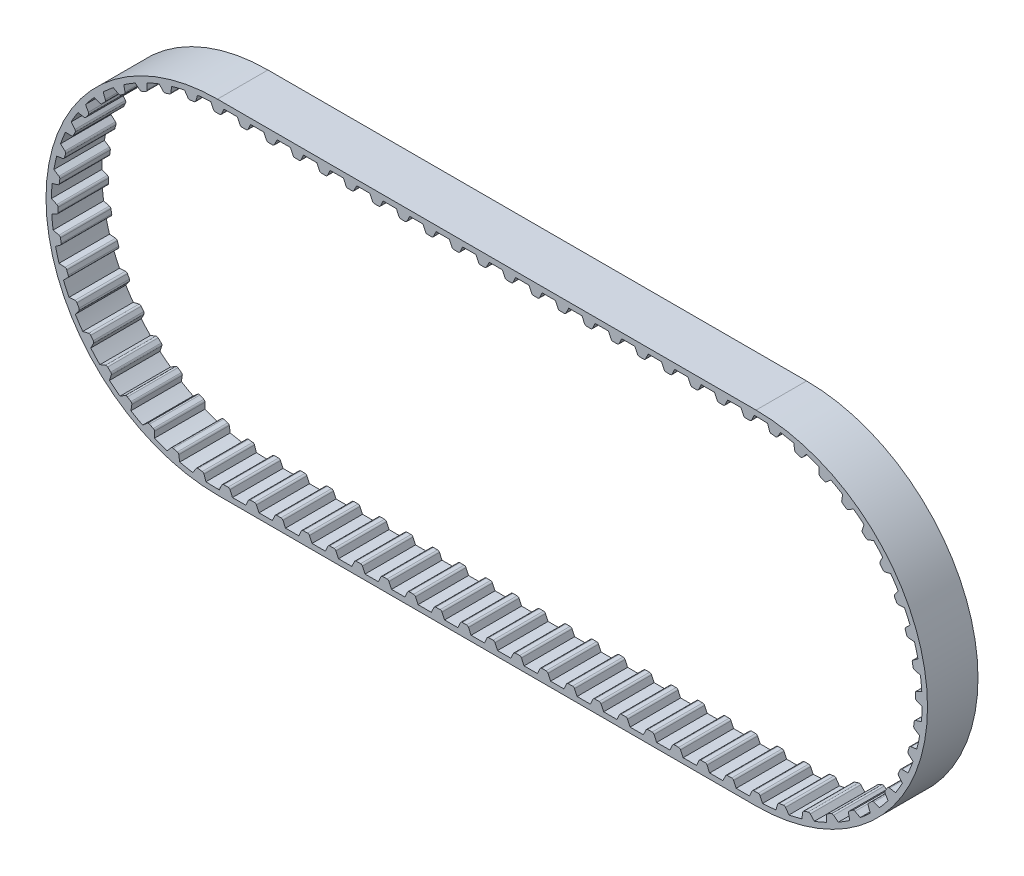
from build123d import *

# Parameters (mm, degrees)
BOSS_EXTRUDE1_DEPTH      = 4.7625
BOSS_EXTRUDE1_DEPTH_BACK = 4.7625
BOSS_EXTRUDE2_DEPTH      = 4.7625
FILLET1_R                = 0.396875
CRVPATTERN1_START        = -4.7625
CRVPATTERN1_DEPTH        = 9.525


# Read off the part's stored shape, not the designer's step: CrvPattern1
with BuildPart() as part:
    # Sketch4 → Boss-Extrude1 (new, two sides: drawn at the far end of the back side and taken through both)
    with BuildSketch(Plane.XY.offset(-BOSS_EXTRUDE1_DEPTH_BACK)):
        with BuildLine():
            Line((-50.8, -32.340284436), (50.8, -32.340284436))
            ThreePointArc((50.8, -32.340284436), (83.140284436, 0), (50.8, 32.340284436))
            Line((50.8, 32.340284436), (-50.8, 32.340284436))
            ThreePointArc((-50.8, 32.340284436), (-83.140284436, 0), (-50.8, -32.340284436))
        make_face()
        with BuildLine():
            Line((-50.8, -31.324284436), (50.8, -31.324284436))
            ThreePointArc((50.8, -31.324284436), (82.124284436, 0), (50.8, 31.324284436))
            Line((50.8, 31.324284436), (-50.8, 31.324284436))
            ThreePointArc((-50.8, 31.324284436), (-82.124284436, 0), (-50.8, -31.324284436))
        make_face(mode=Mode.SUBTRACT)
    extrude(amount=BOSS_EXTRUDE1_DEPTH + BOSS_EXTRUDE1_DEPTH_BACK)

    # Sketch5 → Boss-Extrude2 (add, symmetric)
    with BuildSketch(Plane.XY):
        Polygon((-52.0446, 31.324284436), (-51.452389274, 30.054284436), (-50.147610726, 30.054284436), (-49.5554, 31.324284436), align=None)
    extrude(amount=BOSS_EXTRUDE2_DEPTH, both=True)

    # Fillet1
    fillet1_edges = [part.edges().sort_by_distance(p)[0] for p in [
        (-51.452389274, 30.054284436, 0),
        (-50.147610726, 30.054284436, 0),
    ]]
    fillet(fillet1_edges, radius=FILLET1_R)

    # CrvPattern1 outline → CrvPattern1 (add)
    with BuildSketch(Plane.XY.offset(CRVPATTERN1_START)):
        with BuildLine():
            Line((-45.040553536, 30.283432814), (-44.555196453, 31.324284436))
            Line((-44.555196453, 31.324284436), (-47.044396453, 31.324284436))
            Line((-47.044396453, 31.324284436), (-46.559039371, 30.283432814))
            ThreePointArc((-46.559039371, 30.283432814), (-46.41258925, 30.116438456), (-46.199348468, 30.054284436))
            Line((-46.199348468, 30.054284436), (-45.400244439, 30.054284436))
            ThreePointArc((-45.400244439, 30.054284436), (-45.187003657, 30.116438456), (-45.040553536, 30.283432814))
        make_face()
        with BuildLine():
            Line((-40.040349989, 30.283432814), (-39.554992907, 31.324284436))
            Line((-39.554992907, 31.324284436), (-42.044192907, 31.324284436))
            Line((-42.044192907, 31.324284436), (-41.558835824, 30.283432814))
            ThreePointArc((-41.558835824, 30.283432814), (-41.412385703, 30.116438456), (-41.199144921, 30.054284436))
            Line((-41.199144921, 30.054284436), (-40.400040892, 30.054284436))
            ThreePointArc((-40.400040892, 30.054284436), (-40.18680011, 30.116438456), (-40.040349989, 30.283432814))
        make_face()
        with BuildLine():
            Line((-35.040146443, 30.283432814), (-34.55478936, 31.324284436))
            Line((-34.55478936, 31.324284436), (-37.04398936, 31.324284436))
            Line((-37.04398936, 31.324284436), (-36.558632278, 30.283432814))
            ThreePointArc((-36.558632278, 30.283432814), (-36.412182157, 30.116438456), (-36.198941375, 30.054284436))
            Line((-36.198941375, 30.054284436), (-35.399837346, 30.054284436))
            ThreePointArc((-35.399837346, 30.054284436), (-35.186596564, 30.116438456), (-35.040146443, 30.283432814))
        make_face()
        with BuildLine():
            Line((-30.039942896, 30.283432814), (-29.554585814, 31.324284436))
            Line((-29.554585814, 31.324284436), (-32.043785814, 31.324284436))
            Line((-32.043785814, 31.324284436), (-31.558428731, 30.283432814))
            ThreePointArc((-31.558428731, 30.283432814), (-31.41197861, 30.116438456), (-31.198737828, 30.054284436))
            Line((-31.198737828, 30.054284436), (-30.399633799, 30.054284436))
            ThreePointArc((-30.399633799, 30.054284436), (-30.186393017, 30.116438456), (-30.039942896, 30.283432814))
        make_face()
        with BuildLine():
            Line((-25.03973935, 30.283432814), (-24.554382267, 31.324284436))
            Line((-24.554382267, 31.324284436), (-27.043582267, 31.324284436))
            Line((-27.043582267, 31.324284436), (-26.558225184, 30.283432814))
            ThreePointArc((-26.558225184, 30.283432814), (-26.411775063, 30.116438456), (-26.198534281, 30.054284436))
            Line((-26.198534281, 30.054284436), (-25.399430253, 30.054284436))
            ThreePointArc((-25.399430253, 30.054284436), (-25.186189471, 30.116438456), (-25.03973935, 30.283432814))
        make_face()
        with BuildLine():
            Line((-20.039535803, 30.283432814), (-19.55417872, 31.324284436))
            Line((-19.55417872, 31.324284436), (-22.04337872, 31.324284436))
            Line((-22.04337872, 31.324284436), (-21.558021638, 30.283432814))
            ThreePointArc((-21.558021638, 30.283432814), (-21.411571517, 30.116438456), (-21.198330735, 30.054284436))
            Line((-21.198330735, 30.054284436), (-20.399226706, 30.054284436))
            ThreePointArc((-20.399226706, 30.054284436), (-20.185985924, 30.116438456), (-20.039535803, 30.283432814))
        make_face()
        with BuildLine():
            Line((-15.039332256, 30.283432814), (-14.553975174, 31.324284436))
            Line((-14.553975174, 31.324284436), (-17.043175174, 31.324284436))
            Line((-17.043175174, 31.324284436), (-16.557818091, 30.283432814))
            ThreePointArc((-16.557818091, 30.283432814), (-16.41136797, 30.116438456), (-16.198127188, 30.054284436))
            Line((-16.198127188, 30.054284436), (-15.399023159, 30.054284436))
            ThreePointArc((-15.399023159, 30.054284436), (-15.185782377, 30.116438456), (-15.039332256, 30.283432814))
        make_face()
        with BuildLine():
            Line((-10.03912871, 30.283432814), (-9.553771627, 31.324284436))
            Line((-9.553771627, 31.324284436), (-12.042971627, 31.324284436))
            Line((-12.042971627, 31.324284436), (-11.557614545, 30.283432814))
            ThreePointArc((-11.557614545, 30.283432814), (-11.411164424, 30.116438456), (-11.197923642, 30.054284436))
            Line((-11.197923642, 30.054284436), (-10.398819613, 30.054284436))
            ThreePointArc((-10.398819613, 30.054284436), (-10.185578831, 30.116438456), (-10.03912871, 30.283432814))
        make_face()
        with BuildLine():
            Line((-5.038925163, 30.283432814), (-4.553568081, 31.324284436))
            Line((-4.553568081, 31.324284436), (-7.042768081, 31.324284436))
            Line((-7.042768081, 31.324284436), (-6.557410998, 30.283432814))
            ThreePointArc((-6.557410998, 30.283432814), (-6.410960877, 30.116438456), (-6.197720095, 30.054284436))
            Line((-6.197720095, 30.054284436), (-5.398616066, 30.054284436))
            ThreePointArc((-5.398616066, 30.054284436), (-5.185375284, 30.116438456), (-5.038925163, 30.283432814))
        make_face()
        with BuildLine():
            Line((-0.038721617, 30.283432814), (0.446635466, 31.324284436))
            Line((0.446635466, 31.324284436), (-2.042564534, 31.324284436))
            Line((-2.042564534, 31.324284436), (-1.557207451, 30.283432814))
            ThreePointArc((-1.557207451, 30.283432814), (-1.41075733, 30.116438456), (-1.197516548, 30.054284436))
            Line((-1.197516548, 30.054284436), (-0.39841252, 30.054284436))
            ThreePointArc((-0.39841252, 30.054284436), (-0.185171738, 30.116438456), (-0.038721617, 30.283432814))
        make_face()
        with BuildLine():
            Line((4.96148193, 30.283432814), (5.446839013, 31.324284436))
            Line((5.446839013, 31.324284436), (2.957639013, 31.324284436))
            Line((2.957639013, 31.324284436), (3.442996095, 30.283432814))
            ThreePointArc((3.442996095, 30.283432814), (3.589446216, 30.116438456), (3.802686998, 30.054284436))
            Line((3.802686998, 30.054284436), (4.601791027, 30.054284436))
            ThreePointArc((4.601791027, 30.054284436), (4.815031809, 30.116438456), (4.96148193, 30.283432814))
        make_face()
        with BuildLine():
            Line((9.961685477, 30.283432814), (10.447042559, 31.324284436))
            Line((10.447042559, 31.324284436), (7.957842559, 31.324284436))
            Line((7.957842559, 31.324284436), (8.443199642, 30.283432814))
            ThreePointArc((8.443199642, 30.283432814), (8.589649763, 30.116438456), (8.802890545, 30.054284436))
            Line((8.802890545, 30.054284436), (9.601994574, 30.054284436))
            ThreePointArc((9.601994574, 30.054284436), (9.815235356, 30.116438456), (9.961685477, 30.283432814))
        make_face()
        with BuildLine():
            Line((14.961889023, 30.283432814), (15.447246106, 31.324284436))
            Line((15.447246106, 31.324284436), (12.958046106, 31.324284436))
            Line((12.958046106, 31.324284436), (13.443403188, 30.283432814))
            ThreePointArc((13.443403188, 30.283432814), (13.589853309, 30.116438456), (13.803094091, 30.054284436))
            Line((13.803094091, 30.054284436), (14.60219812, 30.054284436))
            ThreePointArc((14.60219812, 30.054284436), (14.815438902, 30.116438456), (14.961889023, 30.283432814))
        make_face()
        with BuildLine():
            Line((19.96209257, 30.283432814), (20.447449652, 31.324284436))
            Line((20.447449652, 31.324284436), (17.958249652, 31.324284436))
            Line((17.958249652, 31.324284436), (18.443606735, 30.283432814))
            ThreePointArc((18.443606735, 30.283432814), (18.590056856, 30.116438456), (18.803297638, 30.054284436))
            Line((18.803297638, 30.054284436), (19.602401667, 30.054284436))
            ThreePointArc((19.602401667, 30.054284436), (19.815642449, 30.116438456), (19.96209257, 30.283432814))
        make_face()
        with BuildLine():
            Line((24.962296116, 30.283432814), (25.447653199, 31.324284436))
            Line((25.447653199, 31.324284436), (22.958453199, 31.324284436))
            Line((22.958453199, 31.324284436), (23.443810282, 30.283432814))
            ThreePointArc((23.443810282, 30.283432814), (23.590260403, 30.116438456), (23.803501185, 30.054284436))
            Line((23.803501185, 30.054284436), (24.602605213, 30.054284436))
            ThreePointArc((24.602605213, 30.054284436), (24.815845995, 30.116438456), (24.962296116, 30.283432814))
        make_face()
        with BuildLine():
            Line((29.962499663, 30.283432814), (30.447856746, 31.324284436))
            Line((30.447856746, 31.324284436), (27.958656746, 31.324284436))
            Line((27.958656746, 31.324284436), (28.444013828, 30.283432814))
            ThreePointArc((28.444013828, 30.283432814), (28.590463949, 30.116438456), (28.803704731, 30.054284436))
            Line((28.803704731, 30.054284436), (29.60280876, 30.054284436))
            ThreePointArc((29.60280876, 30.054284436), (29.816049542, 30.116438456), (29.962499663, 30.283432814))
        make_face()
        with BuildLine():
            Line((34.96270321, 30.283432814), (35.448060292, 31.324284436))
            Line((35.448060292, 31.324284436), (32.958860292, 31.324284436))
            Line((32.958860292, 31.324284436), (33.444217375, 30.283432814))
            ThreePointArc((33.444217375, 30.283432814), (33.590667496, 30.116438456), (33.803908278, 30.054284436))
            Line((33.803908278, 30.054284436), (34.603012307, 30.054284436))
            ThreePointArc((34.603012307, 30.054284436), (34.816253089, 30.116438456), (34.96270321, 30.283432814))
        make_face()
        with BuildLine():
            Line((39.962906756, 30.283432814), (40.448263839, 31.324284436))
            Line((40.448263839, 31.324284436), (37.959063839, 31.324284436))
            Line((37.959063839, 31.324284436), (38.444420921, 30.283432814))
            ThreePointArc((38.444420921, 30.283432814), (38.590871042, 30.116438456), (38.804111824, 30.054284436))
            Line((38.804111824, 30.054284436), (39.603215853, 30.054284436))
            ThreePointArc((39.603215853, 30.054284436), (39.816456635, 30.116438456), (39.962906756, 30.283432814))
        make_face()
        with BuildLine():
            Line((44.963110303, 30.283432814), (45.448467385, 31.324284436))
            Line((45.448467385, 31.324284436), (42.959267385, 31.324284436))
            Line((42.959267385, 31.324284436), (43.444624468, 30.283432814))
            ThreePointArc((43.444624468, 30.283432814), (43.591074589, 30.116438456), (43.804315371, 30.054284436))
            Line((43.804315371, 30.054284436), (44.6034194, 30.054284436))
            ThreePointArc((44.6034194, 30.054284436), (44.816660182, 30.116438456), (44.963110303, 30.283432814))
        make_face()
        with BuildLine():
            ThreePointArc((-54.557539644, 31.098097872), (-55.77899572, 30.926047226), (-56.992730904, 30.706039786))
            Line((-56.992730904, 30.706039786), (-56.363142713, 29.777746657))
            ThreePointArc((-56.363142713, 29.777746657), (-56.192010709, 29.63615361), (-55.971601553, 29.608684404))
            Line((-55.971601553, 29.608684404), (-55.18265683, 29.735702008))
            ThreePointArc((-55.18265683, 29.735702008), (-54.982006439, 29.830960468), (-54.86396195, 30.019110014))
            Line((-54.86396195, 30.019110014), (-54.557539644, 31.098097872))
        make_face()
        with BuildLine():
            ThreePointArc((-59.452812014, 30.105475244), (-60.631391813, 29.741461471), (-61.794726146, 29.331327832))
            Line((-61.794726146, 29.331327832), (-61.025589928, 28.514909493))
            ThreePointArc((-61.025589928, 28.514909493), (-60.834127371, 28.402318008), (-60.612154127, 28.410232068))
            Line((-60.612154127, 28.410232068), (-59.853429, 28.661037632))
            ThreePointArc((-59.853429, 28.661037632), (-59.670470887, 28.78697842), (-59.583833515, 28.991499126))
            Line((-59.583833515, 28.991499126), (-59.452812014, 30.105475244))
        make_face()
        with BuildLine():
            ThreePointArc((-64.128071588, 28.34736854), (-65.233807669, 27.800647323), (-66.31716135, 27.210815847))
            Line((-66.31716135, 27.210815847), (-65.428033732, 26.527031156))
            ThreePointArc((-65.428033732, 26.527031156), (-65.22110889, 26.446304065), (-65.003215614, 26.489400163))
            Line((-65.003215614, 26.489400163), (-64.29400199, 26.857616519))
            ThreePointArc((-64.29400199, 26.857616519), (-64.133388182, 27.011037371), (-64.080360835, 27.226728942))
            Line((-64.080360835, 27.226728942), (-64.128071588, 28.34736854))
        make_face()
        with BuildLine():
            ThreePointArc((-68.464441757, 25.868480683), (-69.469218856, 25.15295336), (-70.445045735, 24.398421536))
            Line((-70.445045735, 24.398421536), (-69.458534333, 23.864656908))
            ThreePointArc((-69.458534333, 23.864656908), (-69.24140863, 23.817846838), (-69.033135638, 23.895029181))
            Line((-69.033135638, 23.895029181), (-68.391466508, 24.371293788))
            ThreePointArc((-68.391466508, 24.371293788), (-68.25728089, 24.548293713), (-68.239211879, 24.769671815))
            Line((-68.239211879, 24.769671815), (-68.464441757, 25.868480683))
        make_face()
        with BuildLine():
            ThreePointArc((-72.351662768, 22.731841706), (-73.22993268, 21.865701804), (-74.073420661, 20.965654919))
            Line((-74.073420661, 20.965654919), (-73.014609243, 20.595482246))
            ThreePointArc((-73.014609243, 20.595482246), (-72.792803478, 20.583779426), (-72.599446473, 20.693085518))
            Line((-72.599446473, 20.693085518), (-72.041637389, 21.26528852))
            ThreePointArc((-72.041637389, 21.26528852), (-71.937291865, 21.461366986), (-71.954640626, 21.682802696))
            Line((-71.954640626, 21.682802696), (-72.351662768, 22.731841706))
        make_face()
        with BuildLine():
            ThreePointArc((-75.690895265, 19.017206113), (-76.42032645, 18.022476745), (-77.110028383, 16.999800055))
            Line((-77.110028383, 16.999800055), (-76.005839072, 16.802631623))
            ThreePointArc((-76.005839072, 16.802631623), (-75.784993042, 16.826333617), (-75.611468462, 16.964984161))
            Line((-75.611468462, 16.964984161), (-75.151702691, 17.6185763))
            ThreePointArc((-75.151702691, 17.6185763), (-75.079850427, 17.828747672), (-75.132175838, 18.044610602))
            Line((-75.132175838, 18.044610602), (-75.690895265, 19.017206113))
        make_face()
        with BuildLine():
            ThreePointArc((-78.397233452, 14.819024975), (-78.959278854, 13.720998865), (-79.477657868, 12.601695704))
            Line((-79.477657868, 12.601695704), (-78.356166597, 12.582544864))
            ThreePointArc((-78.356166597, 12.582544864), (-78.141895697, 12.641049007), (-77.992615706, 12.805518571))
            Line((-77.992615706, 12.805518571), (-77.642583593, 13.523881132))
            ThreePointArc((-77.642583593, 13.523881132), (-77.605051557, 13.742801436), (-77.691023154, 13.947602896))
            Line((-77.691023154, 13.947602896), (-78.397233452, 14.819024975))
        make_face()
        with BuildLine():
            ThreePointArc((-80.401863975, 10.244044349), (-80.78223261, 9.070640722), (-81.116108018, 7.88317132))
            Line((-81.116108018, 7.88317132), (-80.005830654, 8.042525015))
            ThreePointArc((-80.005830654, 8.042525015), (-79.803583094, 8.134343737), (-79.682343395, 8.320450397))
            Line((-79.682343395, 8.320450397), (-79.450945115, 9.085317761))
            ThreePointArc((-79.450945115, 9.085317761), (-79.448687626, 9.307420568), (-79.56611943, 9.495953124))
            Line((-79.56611943, 9.495953124), (-80.401863975, 10.244044349))
        make_face()
        with BuildLine():
            ThreePointArc((-81.653815615, 5.408591077), (-81.84283595, 4.189645761), (-81.983718388, 2.964203592))
            Line((-81.983718388, 2.964203592), (-80.912885663, 3.298009977))
            ThreePointArc((-80.912885663, 3.298009977), (-80.727803939, 3.420808628), (-80.637687264, 3.623820298))
            Line((-80.637687264, 3.623820298), (-80.53080652, 4.415744382))
            ThreePointArc((-80.53080652, 4.415744382), (-80.563880977, 4.635382343), (-80.709787082, 4.802852227))
            Line((-80.709787082, 4.802852227), (-81.653815615, 5.408591077))
        make_face()
        with BuildLine():
            ThreePointArc((-82.121255323, 0.435614968), (-82.114121187, -0.797878231), (-82.058428474, -2.030134167))
            Line((-82.058428474, -2.030134167), (-81.054268175, -1.530362701))
            ThreePointArc((-81.054268175, -1.530362701), (-80.891058311, -1.379706491), (-80.834356032, -1.164951735))
            Line((-80.834356032, -1.164951735), (-80.854710454, -0.366106978))
            ThreePointArc((-80.854710454, -0.366106978), (-80.922275882, -0.154518542), (-81.09294637, -0.012369543))
            Line((-81.09294637, -0.012369543), (-82.121255323, 0.435614968))
        make_face()
        with BuildLine():
            ThreePointArc((-81.792297633, -4.548437409), (-81.589190424, -5.765114783), (-81.338338644, -6.972852235))
            Line((-81.338338644, -6.972852235), (-80.426383291, -6.319823246))
            ThreePointArc((-80.426383291, -6.319823246), (-80.289195183, -6.145140172), (-80.267349054, -5.924102845))
            Line((-80.267349054, -5.924102845), (-80.414421095, -5.138649432))
            ThreePointArc((-80.414421095, -5.138649432), (-80.514759526, -4.940490524), (-80.705854803, -4.827276796))
            Line((-80.705854803, -4.827276796), (-81.792297633, -4.548437409))
        make_face()
        with BuildLine():
            ThreePointArc((-80.675306865, -9.416837853), (-80.281390937, -10.585763262), (-79.841758433, -11.738273405))
            Line((-79.841758433, -11.738273405), (-79.045196079, -10.948591291))
            ThreePointArc((-79.045196079, -10.948591291), (-78.937517973, -10.754322975), (-78.951083469, -10.532623334))
            Line((-78.951083469, -10.532623334), (-79.221133567, -9.780532785))
            ThreePointArc((-79.221133567, -9.780532785), (-79.351693721, -9.600841941), (-79.558354858, -9.519442139))
            Line((-79.558354858, -9.519442139), (-80.675306865, -9.416837853))
        make_face()
        with BuildLine():
            ThreePointArc((-78.798684453, -14.045798814), (-78.223975804, -15.137250296), (-77.606740997, -16.205228556))
            Line((-77.606740997, -16.205228556), (-76.945825624, -15.298972358))
            ThreePointArc((-76.945825624, -15.298972358), (-76.870395423, -15.090058409), (-76.919027619, -14.873333554))
            Line((-76.919027619, -14.873333554), (-77.30518928, -14.17372908))
            ThreePointArc((-77.30518928, -14.17372908), (-77.462651438, -14.017075251), (-77.679623716, -13.969559108))
            Line((-77.679623716, -13.969559108), (-78.798684453, -14.045798814))
        make_face()
        with BuildLine():
            ThreePointArc((-76.210146786, -18.317620908), (-75.469258383, -19.303846411), (-74.690115542, -20.260137582))
            Line((-74.690115542, -20.260137582), (-74.181652073, -19.260350441))
            ThreePointArc((-74.181652073, -19.260350441), (-74.140387721, -19.04210286), (-74.222850059, -18.835863397))
            Line((-74.222850059, -18.835863397), (-74.715304451, -18.206533657))
            ThreePointArc((-74.715304451, -18.206533657), (-74.895664864, -18.07690004), (-75.117431385, -18.064475736))
            Line((-75.117431385, -18.064475736), (-76.210146786, -18.317620908))
        make_face()
        with BuildLine():
            ThreePointArc((-72.975511937, -22.123685628), (-72.087282156, -22.979608653), (-71.166042343, -23.799897368))
            Line((-71.166042343, -23.799897368), (-70.822959347, -22.732000611))
            ThreePointArc((-70.822959347, -22.732000611), (-70.816910062, -22.509968722), (-70.931105793, -22.319458648))
            Line((-70.931105793, -22.319458648), (-71.517331406, -21.776405447))
            ThreePointArc((-71.517331406, -21.776405447), (-71.716004097, -21.677088202), (-71.936926062, -21.700071646))
            Line((-71.936926062, -21.700071646), (-72.975511937, -22.123685628))
        make_face()
        with BuildLine():
            ThreePointArc((-69.177026124, -25.367217157), (-68.164039752, -26.071074372), (-67.124127091, -26.734503365))
            Line((-67.124127091, -26.734503365), (-66.95514805, -25.625650124))
            ThreePointArc((-66.95514805, -25.625650124), (-66.984467645, -25.405479475), (-67.127493144, -25.23554284))
            Line((-67.127493144, -25.23554284), (-67.792584173, -24.792574249))
            ThreePointArc((-67.792584173, -24.792574249), (-68.004517543, -24.72609869), (-68.218977626, -24.783905488))
            Line((-68.218977626, -24.783905488), (-69.177026124, -25.367217157))
        make_face()
        with BuildLine():
            ThreePointArc((-64.911272455, -27.965743064), (-63.799286433, -28.499637676), (-62.667142513, -28.989338109))
            Line((-62.667142513, -28.989338109), (-62.676564012, -27.867722907))
            ThreePointArc((-62.676564012, -27.867722907), (-62.740506986, -27.65501172), (-62.908725581, -27.509969458))
            Line((-62.908725581, -27.509969458), (-63.63577093, -27.178348725))
            ThreePointArc((-63.63577093, -27.178348725), (-63.855576204, -27.146405108), (-64.058121385, -27.237565422))
            Line((-64.058121385, -27.237565422), (-64.911272455, -27.965743064))
        make_face()
        with BuildLine():
            ThreePointArc((-60.286715137, -29.853191309), (-59.104003644, -30.203548118), (-57.908415193, -30.507068507))
            Line((-57.908415193, -30.507068507), (-58.095997676, -29.401210361))
            ThreePointArc((-58.095997676, -29.401210361), (-58.192938167, -29.201367186), (-58.382072608, -29.08490725))
            Line((-58.382072608, -29.08490725), (-59.152585883, -28.873066409))
            ThreePointArc((-59.152585883, -28.873066409), (-59.374674131, -28.876466956), (-59.560154346, -28.998662877))
            Line((-59.560154346, -28.998662877), (-60.286715137, -29.853191309))
        make_face()
        with BuildLine():
            ThreePointArc((-55.420941586, -30.981570236), (-54.197577118, -31.139480811), (-52.968944053, -31.249103621))
            Line((-52.968944053, -31.249103621), (-53.329917907, -30.187120899))
            ThreePointArc((-53.329917907, -30.187120899), (-53.457391036, -30.005227098), (-53.66263225, -29.920310683))
            Line((-53.66263225, -29.920310683), (-54.457021811, -29.833636156))
            ThreePointArc((-54.457021811, -29.833636156), (-54.675746051, -29.872294402), (-54.839445144, -30.022418885))
            Line((-54.839445144, -30.022418885), (-55.420941586, -30.981570236))
        make_face()
        with BuildLine():
            Line((-50.448670932, -31.324284436), (-47.959470932, -31.324284436))
            Line((-47.959470932, -31.324284436), (-48.444828015, -30.283432814))
            ThreePointArc((-48.444828015, -30.283432814), (-48.591278136, -30.116438456), (-48.804518918, -30.054284436))
            Line((-48.804518918, -30.054284436), (-49.603622946, -30.054284436))
            ThreePointArc((-49.603622946, -30.054284436), (-49.816863728, -30.116438456), (-49.963313849, -30.283432814))
            Line((-49.963313849, -30.283432814), (-50.448670932, -31.324284436))
        make_face()
        with BuildLine():
            Line((-45.448467385, -31.324284436), (-42.959267385, -31.324284436))
            Line((-42.959267385, -31.324284436), (-43.444624468, -30.283432814))
            ThreePointArc((-43.444624468, -30.283432814), (-43.591074589, -30.116438456), (-43.804315371, -30.054284436))
            Line((-43.804315371, -30.054284436), (-44.6034194, -30.054284436))
            ThreePointArc((-44.6034194, -30.054284436), (-44.816660182, -30.116438456), (-44.963110303, -30.283432814))
            Line((-44.963110303, -30.283432814), (-45.448467385, -31.324284436))
        make_face()
        with BuildLine():
            Line((-40.448263839, -31.324284436), (-37.959063839, -31.324284436))
            Line((-37.959063839, -31.324284436), (-38.444420921, -30.283432814))
            ThreePointArc((-38.444420921, -30.283432814), (-38.590871042, -30.116438456), (-38.804111824, -30.054284436))
            Line((-38.804111824, -30.054284436), (-39.603215853, -30.054284436))
            ThreePointArc((-39.603215853, -30.054284436), (-39.816456635, -30.116438456), (-39.962906756, -30.283432814))
            Line((-39.962906756, -30.283432814), (-40.448263839, -31.324284436))
        make_face()
        with BuildLine():
            Line((-35.448060292, -31.324284436), (-32.958860292, -31.324284436))
            Line((-32.958860292, -31.324284436), (-33.444217375, -30.283432814))
            ThreePointArc((-33.444217375, -30.283432814), (-33.590667496, -30.116438456), (-33.803908278, -30.054284436))
            Line((-33.803908278, -30.054284436), (-34.603012307, -30.054284436))
            ThreePointArc((-34.603012307, -30.054284436), (-34.816253089, -30.116438456), (-34.96270321, -30.283432814))
            Line((-34.96270321, -30.283432814), (-35.448060292, -31.324284436))
        make_face()
        with BuildLine():
            Line((-30.447856746, -31.324284436), (-27.958656746, -31.324284436))
            Line((-27.958656746, -31.324284436), (-28.444013828, -30.283432814))
            ThreePointArc((-28.444013828, -30.283432814), (-28.590463949, -30.116438456), (-28.803704731, -30.054284436))
            Line((-28.803704731, -30.054284436), (-29.60280876, -30.054284436))
            ThreePointArc((-29.60280876, -30.054284436), (-29.816049542, -30.116438456), (-29.962499663, -30.283432814))
            Line((-29.962499663, -30.283432814), (-30.447856746, -31.324284436))
        make_face()
        with BuildLine():
            Line((-25.447653199, -31.324284436), (-22.958453199, -31.324284436))
            Line((-22.958453199, -31.324284436), (-23.443810282, -30.283432814))
            ThreePointArc((-23.443810282, -30.283432814), (-23.590260403, -30.116438456), (-23.803501185, -30.054284436))
            Line((-23.803501185, -30.054284436), (-24.602605213, -30.054284436))
            ThreePointArc((-24.602605213, -30.054284436), (-24.815845995, -30.116438456), (-24.962296116, -30.283432814))
            Line((-24.962296116, -30.283432814), (-25.447653199, -31.324284436))
        make_face()
        with BuildLine():
            Line((-20.447449652, -31.324284436), (-17.958249652, -31.324284436))
            Line((-17.958249652, -31.324284436), (-18.443606735, -30.283432814))
            ThreePointArc((-18.443606735, -30.283432814), (-18.590056856, -30.116438456), (-18.803297638, -30.054284436))
            Line((-18.803297638, -30.054284436), (-19.602401667, -30.054284436))
            ThreePointArc((-19.602401667, -30.054284436), (-19.815642449, -30.116438456), (-19.96209257, -30.283432814))
            Line((-19.96209257, -30.283432814), (-20.447449652, -31.324284436))
        make_face()
        with BuildLine():
            Line((-15.447246106, -31.324284436), (-12.958046106, -31.324284436))
            Line((-12.958046106, -31.324284436), (-13.443403188, -30.283432814))
            ThreePointArc((-13.443403188, -30.283432814), (-13.589853309, -30.116438456), (-13.803094091, -30.054284436))
            Line((-13.803094091, -30.054284436), (-14.60219812, -30.054284436))
            ThreePointArc((-14.60219812, -30.054284436), (-14.815438902, -30.116438456), (-14.961889023, -30.283432814))
            Line((-14.961889023, -30.283432814), (-15.447246106, -31.324284436))
        make_face()
        with BuildLine():
            Line((-10.447042559, -31.324284436), (-7.957842559, -31.324284436))
            Line((-7.957842559, -31.324284436), (-8.443199642, -30.283432814))
            ThreePointArc((-8.443199642, -30.283432814), (-8.589649763, -30.116438456), (-8.802890545, -30.054284436))
            Line((-8.802890545, -30.054284436), (-9.601994574, -30.054284436))
            ThreePointArc((-9.601994574, -30.054284436), (-9.815235356, -30.116438456), (-9.961685477, -30.283432814))
            Line((-9.961685477, -30.283432814), (-10.447042559, -31.324284436))
        make_face()
        with BuildLine():
            Line((-5.446839013, -31.324284436), (-2.957639013, -31.324284436))
            Line((-2.957639013, -31.324284436), (-3.442996095, -30.283432814))
            ThreePointArc((-3.442996095, -30.283432814), (-3.589446216, -30.116438456), (-3.802686998, -30.054284436))
            Line((-3.802686998, -30.054284436), (-4.601791027, -30.054284436))
            ThreePointArc((-4.601791027, -30.054284436), (-4.815031809, -30.116438456), (-4.96148193, -30.283432814))
            Line((-4.96148193, -30.283432814), (-5.446839013, -31.324284436))
        make_face()
        with BuildLine():
            Line((-0.446635466, -31.324284436), (2.042564534, -31.324284436))
            Line((2.042564534, -31.324284436), (1.557207451, -30.283432814))
            ThreePointArc((1.557207451, -30.283432814), (1.41075733, -30.116438456), (1.197516548, -30.054284436))
            Line((1.197516548, -30.054284436), (0.39841252, -30.054284436))
            ThreePointArc((0.39841252, -30.054284436), (0.185171738, -30.116438456), (0.038721617, -30.283432814))
            Line((0.038721617, -30.283432814), (-0.446635466, -31.324284436))
        make_face()
        with BuildLine():
            Line((4.553568081, -31.324284436), (7.042768081, -31.324284436))
            Line((7.042768081, -31.324284436), (6.557410998, -30.283432814))
            ThreePointArc((6.557410998, -30.283432814), (6.410960877, -30.116438456), (6.197720095, -30.054284436))
            Line((6.197720095, -30.054284436), (5.398616066, -30.054284436))
            ThreePointArc((5.398616066, -30.054284436), (5.185375284, -30.116438456), (5.038925163, -30.283432814))
            Line((5.038925163, -30.283432814), (4.553568081, -31.324284436))
        make_face()
        with BuildLine():
            Line((9.553771627, -31.324284436), (12.042971627, -31.324284436))
            Line((12.042971627, -31.324284436), (11.557614545, -30.283432814))
            ThreePointArc((11.557614545, -30.283432814), (11.411164424, -30.116438456), (11.197923642, -30.054284436))
            Line((11.197923642, -30.054284436), (10.398819613, -30.054284436))
            ThreePointArc((10.398819613, -30.054284436), (10.185578831, -30.116438456), (10.03912871, -30.283432814))
            Line((10.03912871, -30.283432814), (9.553771627, -31.324284436))
        make_face()
        with BuildLine():
            Line((14.553975174, -31.324284436), (17.043175174, -31.324284436))
            Line((17.043175174, -31.324284436), (16.557818091, -30.283432814))
            ThreePointArc((16.557818091, -30.283432814), (16.41136797, -30.116438456), (16.198127188, -30.054284436))
            Line((16.198127188, -30.054284436), (15.399023159, -30.054284436))
            ThreePointArc((15.399023159, -30.054284436), (15.185782377, -30.116438456), (15.039332256, -30.283432814))
            Line((15.039332256, -30.283432814), (14.553975174, -31.324284436))
        make_face()
        with BuildLine():
            Line((19.55417872, -31.324284436), (22.04337872, -31.324284436))
            Line((22.04337872, -31.324284436), (21.558021638, -30.283432814))
            ThreePointArc((21.558021638, -30.283432814), (21.411571517, -30.116438456), (21.198330735, -30.054284436))
            Line((21.198330735, -30.054284436), (20.399226706, -30.054284436))
            ThreePointArc((20.399226706, -30.054284436), (20.185985924, -30.116438456), (20.039535803, -30.283432814))
            Line((20.039535803, -30.283432814), (19.55417872, -31.324284436))
        make_face()
        with BuildLine():
            Line((24.554382267, -31.324284436), (27.043582267, -31.324284436))
            Line((27.043582267, -31.324284436), (26.558225184, -30.283432814))
            ThreePointArc((26.558225184, -30.283432814), (26.411775063, -30.116438456), (26.198534281, -30.054284436))
            Line((26.198534281, -30.054284436), (25.399430253, -30.054284436))
            ThreePointArc((25.399430253, -30.054284436), (25.186189471, -30.116438456), (25.03973935, -30.283432814))
            Line((25.03973935, -30.283432814), (24.554382267, -31.324284436))
        make_face()
        with BuildLine():
            Line((29.554585814, -31.324284436), (32.043785814, -31.324284436))
            Line((32.043785814, -31.324284436), (31.558428731, -30.283432814))
            ThreePointArc((31.558428731, -30.283432814), (31.41197861, -30.116438456), (31.198737828, -30.054284436))
            Line((31.198737828, -30.054284436), (30.399633799, -30.054284436))
            ThreePointArc((30.399633799, -30.054284436), (30.186393017, -30.116438456), (30.039942896, -30.283432814))
            Line((30.039942896, -30.283432814), (29.554585814, -31.324284436))
        make_face()
        with BuildLine():
            Line((34.55478936, -31.324284436), (37.04398936, -31.324284436))
            Line((37.04398936, -31.324284436), (36.558632278, -30.283432814))
            ThreePointArc((36.558632278, -30.283432814), (36.412182157, -30.116438456), (36.198941375, -30.054284436))
            Line((36.198941375, -30.054284436), (35.399837346, -30.054284436))
            ThreePointArc((35.399837346, -30.054284436), (35.186596564, -30.116438456), (35.040146443, -30.283432814))
            Line((35.040146443, -30.283432814), (34.55478936, -31.324284436))
        make_face()
        with BuildLine():
            Line((39.554992907, -31.324284436), (42.044192907, -31.324284436))
            Line((42.044192907, -31.324284436), (41.558835824, -30.283432814))
            ThreePointArc((41.558835824, -30.283432814), (41.412385703, -30.116438456), (41.199144921, -30.054284436))
            Line((41.199144921, -30.054284436), (40.400040892, -30.054284436))
            ThreePointArc((40.400040892, -30.054284436), (40.18680011, -30.116438456), (40.040349989, -30.283432814))
            Line((40.040349989, -30.283432814), (39.554992907, -31.324284436))
        make_face()
        with BuildLine():
            Line((44.555196453, -31.324284436), (47.044396453, -31.324284436))
            Line((47.044396453, -31.324284436), (46.559039371, -30.283432814))
            ThreePointArc((46.559039371, -30.283432814), (46.41258925, -30.116438456), (46.199348468, -30.054284436))
            Line((46.199348468, -30.054284436), (45.400244439, -30.054284436))
            ThreePointArc((45.400244439, -30.054284436), (45.187003657, -30.116438456), (45.040553536, -30.283432814))
            Line((45.040553536, -30.283432814), (44.555196453, -31.324284436))
        make_face()
        with BuildLine():
            ThreePointArc((50.8, -31.324284436), (51.416756915, -31.318212055), (52.033274707, -31.299997267))
            Line((52.033274707, -31.299997267), (51.559242917, -30.283432814))
            ThreePointArc((51.559242917, -30.283432814), (51.412792796, -30.116438456), (51.199552014, -30.054284436))
            Line((51.199552014, -30.054284436), (50.400447986, -30.054284436))
            ThreePointArc((50.400447986, -30.054284436), (50.187207204, -30.116438456), (50.040757083, -30.283432814))
            Line((50.040757083, -30.283432814), (49.5554, -31.324284436))
            Line((49.5554, -31.324284436), (50.8, -31.324284436))
        make_face()
        with BuildLine():
            ThreePointArc((54.557539644, -31.098097872), (55.77899572, -30.926047226), (56.992730904, -30.706039787))
            Line((56.992730904, -30.706039787), (56.363142713, -29.777746657))
            ThreePointArc((56.363142713, -29.777746657), (56.192010709, -29.63615361), (55.971601553, -29.608684404))
            Line((55.971601553, -29.608684404), (55.18265683, -29.735702008))
            ThreePointArc((55.18265683, -29.735702008), (54.982006439, -29.830960468), (54.86396195, -30.019110014))
            Line((54.86396195, -30.019110014), (54.557539644, -31.098097872))
        make_face()
        with BuildLine():
            ThreePointArc((59.452812014, -30.105475244), (60.631391813, -29.741461471), (61.794726146, -29.331327832))
            Line((61.794726146, -29.331327832), (61.025589928, -28.514909493))
            ThreePointArc((61.025589928, -28.514909493), (60.834127371, -28.402318008), (60.612154127, -28.410232068))
            Line((60.612154127, -28.410232068), (59.853429, -28.661037632))
            ThreePointArc((59.853429, -28.661037632), (59.670470887, -28.78697842), (59.583833515, -28.991499126))
            Line((59.583833515, -28.991499126), (59.452812014, -30.105475244))
        make_face()
        with BuildLine():
            ThreePointArc((64.128071588, -28.347368541), (65.233807669, -27.800647324), (66.31716135, -27.210815847))
            Line((66.31716135, -27.210815847), (65.428033732, -26.527031156))
            ThreePointArc((65.428033732, -26.527031156), (65.22110889, -26.446304065), (65.003215614, -26.489400163))
            Line((65.003215614, -26.489400163), (64.29400199, -26.857616519))
            ThreePointArc((64.29400199, -26.857616519), (64.133388182, -27.011037371), (64.080360835, -27.226728942))
            Line((64.080360835, -27.226728942), (64.128071588, -28.347368541))
        make_face()
        with BuildLine():
            ThreePointArc((68.464441757, -25.868480683), (69.469218857, -25.15295336), (70.445045736, -24.398421537))
            Line((70.445045736, -24.398421537), (69.458534333, -23.864656908))
            ThreePointArc((69.458534333, -23.864656908), (69.24140863, -23.817846838), (69.033135638, -23.895029181))
            Line((69.033135638, -23.895029181), (68.391466508, -24.371293788))
            ThreePointArc((68.391466508, -24.371293788), (68.25728089, -24.548293713), (68.239211879, -24.769671815))
            Line((68.239211879, -24.769671815), (68.464441757, -25.868480683))
        make_face()
        with BuildLine():
            ThreePointArc((72.351662768, -22.731841707), (73.22993268, -21.865701804), (74.073420661, -20.965654919))
            Line((74.073420661, -20.965654919), (73.014609243, -20.595482246))
            ThreePointArc((73.014609243, -20.595482246), (72.792803478, -20.583779426), (72.599446473, -20.693085518))
            Line((72.599446473, -20.693085518), (72.041637389, -21.26528852))
            ThreePointArc((72.041637389, -21.26528852), (71.937291865, -21.461366986), (71.954640626, -21.682802696))
            Line((71.954640626, -21.682802696), (72.351662768, -22.731841707))
        make_face()
        with BuildLine():
            ThreePointArc((75.690895265, -19.017206113), (76.42032645, -18.022476745), (77.110028383, -16.999800055))
            Line((77.110028383, -16.999800055), (76.005839072, -16.802631623))
            ThreePointArc((76.005839072, -16.802631623), (75.784993042, -16.826333617), (75.611468462, -16.964984161))
            Line((75.611468462, -16.964984161), (75.151702691, -17.6185763))
            ThreePointArc((75.151702691, -17.6185763), (75.079850427, -17.828747672), (75.132175838, -18.044610602))
            Line((75.132175838, -18.044610602), (75.690895265, -19.017206113))
        make_face()
        with BuildLine():
            ThreePointArc((78.397233452, -14.819024975), (78.959278854, -13.720998865), (79.477657868, -12.601695704))
            Line((79.477657868, -12.601695704), (78.356166597, -12.582544864))
            ThreePointArc((78.356166597, -12.582544864), (78.141895697, -12.641049007), (77.992615706, -12.805518571))
            Line((77.992615706, -12.805518571), (77.642583593, -13.523881132))
            ThreePointArc((77.642583593, -13.523881132), (77.605051557, -13.742801436), (77.691023154, -13.947602896))
            Line((77.691023154, -13.947602896), (78.397233452, -14.819024975))
        make_face()
        with BuildLine():
            ThreePointArc((80.401863975, -10.244044349), (80.782232611, -9.070640722), (81.116108018, -7.88317132))
            Line((81.116108018, -7.88317132), (80.005830654, -8.042525015))
            ThreePointArc((80.005830654, -8.042525015), (79.803583094, -8.134343737), (79.682343395, -8.320450397))
            Line((79.682343395, -8.320450397), (79.450945115, -9.085317761))
            ThreePointArc((79.450945115, -9.085317761), (79.448687626, -9.307420568), (79.56611943, -9.495953124))
            Line((79.56611943, -9.495953124), (80.401863975, -10.244044349))
        make_face()
        with BuildLine():
            ThreePointArc((81.653815615, -5.408591077), (81.84283595, -4.189645761), (81.983718388, -2.964203592))
            Line((81.983718388, -2.964203592), (80.912885663, -3.298009977))
            ThreePointArc((80.912885663, -3.298009977), (80.727803939, -3.420808628), (80.637687264, -3.623820298))
            Line((80.637687264, -3.623820298), (80.53080652, -4.415744382))
            ThreePointArc((80.53080652, -4.415744382), (80.563880977, -4.635382343), (80.709787082, -4.802852227))
            Line((80.709787082, -4.802852227), (81.653815615, -5.408591077))
        make_face()
        with BuildLine():
            ThreePointArc((82.121255323, -0.435614968), (82.114121188, 0.797878231), (82.058428474, 2.030134167))
            Line((82.058428474, 2.030134167), (81.054268175, 1.530362701))
            ThreePointArc((81.054268175, 1.530362701), (80.891058311, 1.379706491), (80.834356032, 1.164951735))
            Line((80.834356032, 1.164951735), (80.854710454, 0.366106978))
            ThreePointArc((80.854710454, 0.366106978), (80.922275882, 0.154518542), (81.09294637, 0.012369543))
            Line((81.09294637, 0.012369543), (82.121255323, -0.435614968))
        make_face()
        with BuildLine():
            ThreePointArc((81.792297633, 4.548437409), (81.589190424, 5.765114783), (81.338338644, 6.972852235))
            Line((81.338338644, 6.972852235), (80.426383291, 6.319823246))
            ThreePointArc((80.426383291, 6.319823246), (80.289195183, 6.145140172), (80.267349054, 5.924102845))
            Line((80.267349054, 5.924102845), (80.414421095, 5.138649432))
            ThreePointArc((80.414421095, 5.138649432), (80.514759526, 4.940490524), (80.705854803, 4.827276796))
            Line((80.705854803, 4.827276796), (81.792297633, 4.548437409))
        make_face()
        with BuildLine():
            ThreePointArc((80.675306865, 9.416837853), (80.281390937, 10.585763262), (79.841758433, 11.738273405))
            Line((79.841758433, 11.738273405), (79.045196079, 10.948591291))
            ThreePointArc((79.045196079, 10.948591291), (78.937517973, 10.754322975), (78.951083469, 10.532623334))
            Line((78.951083469, 10.532623334), (79.221133567, 9.780532785))
            ThreePointArc((79.221133567, 9.780532785), (79.351693721, 9.600841941), (79.558354858, 9.519442139))
            Line((79.558354858, 9.519442139), (80.675306865, 9.416837853))
        make_face()
        with BuildLine():
            ThreePointArc((78.798684453, 14.045798814), (78.223975804, 15.137250296), (77.606740997, 16.205228556))
            Line((77.606740997, 16.205228556), (76.945825624, 15.298972358))
            ThreePointArc((76.945825624, 15.298972358), (76.870395423, 15.090058409), (76.919027619, 14.873333554))
            Line((76.919027619, 14.873333554), (77.30518928, 14.17372908))
            ThreePointArc((77.30518928, 14.17372908), (77.462651438, 14.017075251), (77.679623716, 13.969559108))
            Line((77.679623716, 13.969559108), (78.798684453, 14.045798814))
        make_face()
        with BuildLine():
            ThreePointArc((76.210146786, 18.317620908), (75.469258383, 19.303846411), (74.690115542, 20.260137582))
            Line((74.690115542, 20.260137582), (74.181652073, 19.260350441))
            ThreePointArc((74.181652073, 19.260350441), (74.140387721, 19.04210286), (74.222850059, 18.835863397))
            Line((74.222850059, 18.835863397), (74.715304451, 18.206533657))
            ThreePointArc((74.715304451, 18.206533657), (74.895664864, 18.07690004), (75.117431385, 18.064475736))
            Line((75.117431385, 18.064475736), (76.210146786, 18.317620908))
        make_face()
        with BuildLine():
            ThreePointArc((72.975511937, 22.123685628), (72.087282156, 22.979608653), (71.166042343, 23.799897368))
            Line((71.166042343, 23.799897368), (70.822959347, 22.732000611))
            ThreePointArc((70.822959347, 22.732000611), (70.816910062, 22.509968722), (70.931105793, 22.319458648))
            Line((70.931105793, 22.319458648), (71.517331406, 21.776405447))
            ThreePointArc((71.517331406, 21.776405447), (71.716004097, 21.677088202), (71.936926062, 21.700071646))
            Line((71.936926062, 21.700071646), (72.975511937, 22.123685628))
        make_face()
        with BuildLine():
            ThreePointArc((69.177026124, 25.367217157), (68.164039752, 26.071074372), (67.124127091, 26.734503365))
            Line((67.124127091, 26.734503365), (66.95514805, 25.625650124))
            ThreePointArc((66.95514805, 25.625650124), (66.984467645, 25.405479475), (67.127493144, 25.23554284))
            Line((67.127493144, 25.23554284), (67.792584173, 24.792574249))
            ThreePointArc((67.792584173, 24.792574249), (68.004517543, 24.72609869), (68.218977626, 24.783905488))
            Line((68.218977626, 24.783905488), (69.177026124, 25.367217157))
        make_face()
        with BuildLine():
            ThreePointArc((64.911272455, 27.965743064), (63.799286433, 28.499637676), (62.667142513, 28.989338109))
            Line((62.667142513, 28.989338109), (62.676564012, 27.867722907))
            ThreePointArc((62.676564012, 27.867722907), (62.740506986, 27.65501172), (62.908725581, 27.509969458))
            Line((62.908725581, 27.509969458), (63.63577093, 27.178348725))
            ThreePointArc((63.63577093, 27.178348725), (63.855576204, 27.146405108), (64.058121385, 27.237565422))
            Line((64.058121385, 27.237565422), (64.911272455, 27.965743064))
        make_face()
        with BuildLine():
            ThreePointArc((60.286715137, 29.853191309), (59.104003644, 30.203548118), (57.908415193, 30.507068507))
            Line((57.908415193, 30.507068507), (58.095997676, 29.401210361))
            ThreePointArc((58.095997676, 29.401210361), (58.192938167, 29.201367186), (58.382072608, 29.08490725))
            Line((58.382072608, 29.08490725), (59.152585883, 28.873066409))
            ThreePointArc((59.152585883, 28.873066409), (59.374674131, 28.876466956), (59.560154346, 28.998662877))
            Line((59.560154346, 28.998662877), (60.286715137, 29.853191309))
        make_face()
        with BuildLine():
            ThreePointArc((55.420941586, 30.981570236), (54.197577118, 31.139480811), (52.968944053, 31.249103621))
            Line((52.968944053, 31.249103621), (53.329917907, 30.187120899))
            ThreePointArc((53.329917907, 30.187120899), (53.457391036, 30.005227098), (53.66263225, 29.920310683))
            Line((53.66263225, 29.920310683), (54.457021811, 29.833636156))
            ThreePointArc((54.457021811, 29.833636156), (54.675746051, 29.872294402), (54.839445144, 30.022418885))
            Line((54.839445144, 30.022418885), (55.420941586, 30.981570236))
        make_face()
        with BuildLine():
            Line((48.804518918, 30.054284436), (49.603622946, 30.054284436))
            ThreePointArc((49.603622946, 30.054284436), (49.816863728, 30.116438456), (49.963313849, 30.283432814))
            Line((49.963313849, 30.283432814), (50.448670932, 31.324284436))
            Line((50.448670932, 31.324284436), (47.959470932, 31.324284436))
            Line((47.959470932, 31.324284436), (48.444828015, 30.283432814))
            ThreePointArc((48.444828015, 30.283432814), (48.591278136, 30.116438456), (48.804518918, 30.054284436))
        make_face()
    extrude(amount=CRVPATTERN1_DEPTH)


solid = part.part
